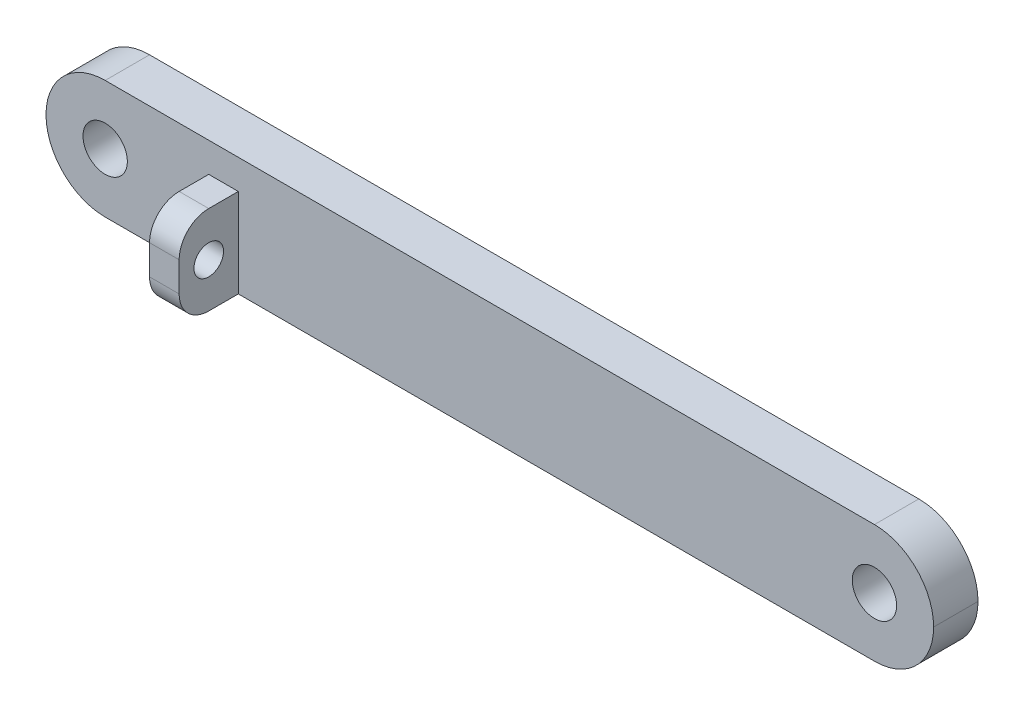
from build123d import *

# Parameters (mm, degrees)
SZKIC1_W                    = 60
SZKIC1_H                    = 8
DODANIE_WYCI_GNI_CIE1_DEPTH = 3
ZAOKR_GLENIE1_R             = 4
SZKIC2_R                    = 1.5
WYTNIJ_WYCI_GNI_CIE1_DEPTH  = 3
SZKIC3_W                    = 2
SZKIC3_H                    = 6
DODANIE_WYCI_GNI_CIE2_DEPTH = 4
WYTNIJ_WYCI_GNI_CIE2_REACH  = 52.14
SZKIC4_R                    = 1
ZAOKR_GLENIE2_R             = 2


with BuildPart() as part:
    # Szkic1 → Dodanie-wyciągnięcie1 (new body)
    with BuildSketch(Plane.XY):
        with Locations((30, 4)):
            Rectangle(SZKIC1_W, SZKIC1_H)
    extrude(amount=DODANIE_WYCI_GNI_CIE1_DEPTH)

    # Zaokrąglenie1
    zaokr_glenie1_edges = [part.edges().sort_by_distance(p)[0] for p in [
        (0, 0, 1.5),
        (0, 8, 1.5),
        (60, 8, 1.5),
        (60, 0, 1.5),
    ]]
    fillet(zaokr_glenie1_edges, radius=ZAOKR_GLENIE1_R - 0.0001)  # a hair under: the kernel refuses the full size

    # Szkic2 → Wytnij-wyciągnięcie1 (cut)
    with BuildSketch(Plane.XY.offset(3)):
        with Locations((4, 4)):
            Circle(SZKIC2_R)
        with Locations((56, 4)):
            Circle(SZKIC2_R)
    extrude(amount=-WYTNIJ_WYCI_GNI_CIE1_DEPTH, mode=Mode.SUBTRACT)

    # Szkic3 → Dodanie-wyciągnięcie2 (add)
    with BuildSketch(Plane.XY.offset(3)):
        with Locations((12, 3)):
            Rectangle(SZKIC3_W, SZKIC3_H)
    extrude(amount=DODANIE_WYCI_GNI_CIE2_DEPTH)

    # Szkic4 → Wytnij-wyciągnięcie2 (cut, up to next)
    with BuildSketch(Plane.ZY.offset(-11), mode=Mode.PRIVATE) as wytnij_wyci_gni_cie2_sk1:
        with Locations((5, 3)):
            Circle(SZKIC4_R)
    wytnij_wyci_gni_cie2_tool1 = extrude(wytnij_wyci_gni_cie2_sk1.sketch, amount=-WYTNIJ_WYCI_GNI_CIE2_REACH, mode=Mode.PRIVATE) & part.part
    add(wytnij_wyci_gni_cie2_tool1.solids().sort_by_distance((11, 3, 5))[0], mode=Mode.SUBTRACT)

    # Zaokrąglenie2
    zaokr_glenie2_edges = [part.edges().sort_by_distance(p)[0] for p in [
        (12, 0, 7),
        (12, 6, 7),
    ]]
    fillet(zaokr_glenie2_edges, radius=ZAOKR_GLENIE2_R)


solid = part.part
